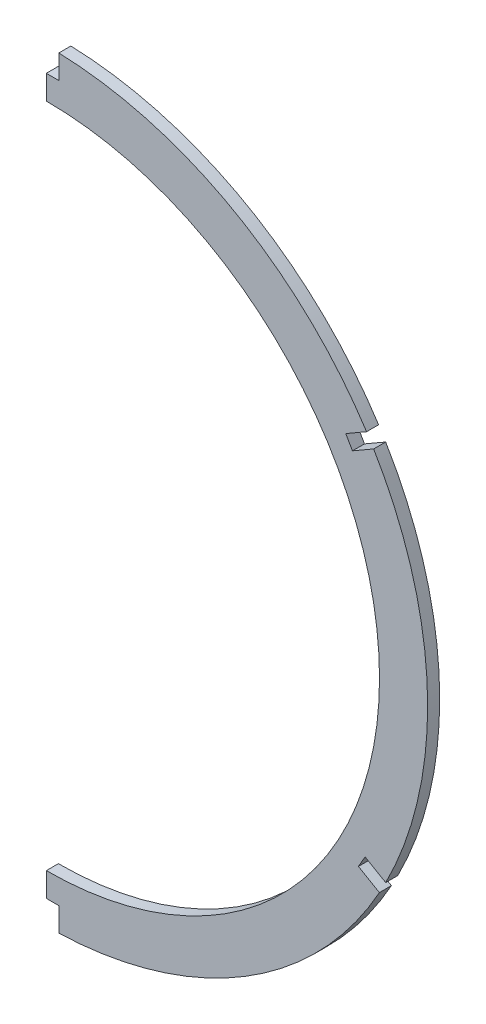
from build123d import *

# Parameters (mm, degrees)
BOSS_EXTRUDE1_DEPTH = 3.175
SKETCH3_W           = 149.303507008
SKETCH3_H           = 288.678903575
CUT_EXTRUDE1_DEPTH  = 147.667755045
SKETCH4_W           = 3.302
SKETCH4_H           = 9.965839279
CUT_EXTRUDE2_DEPTH  = 147.667755044


with BuildPart() as part:
    # Sketch2 → Boss-Extrude1 (new body)
    with BuildSketch(Plane.XY):
        with BuildLine():
            ThreePointArc((-1.783927604, 106.664181958), (-86.289926541, 57.796410124), (-89.548347912, -39.767444199))
            ThreePointArc((-89.548347912, -39.767444199), (-89.139366423, -40.557656379), (-88.723411943, -41.344220438))
            ThreePointArc((-88.723411943, -41.344220438), (-88.300763494, -42.126623343), (-87.87121564, -42.905259753))
            ThreePointArc((-87.87121564, -42.905259753), (0, -94.523651503), (87.87121564, -42.905259753))
            ThreePointArc((87.87121564, -42.905259753), (88.300763494, -42.126623343), (88.723411943, -41.344220438))
            ThreePointArc((88.723411943, -41.344220438), (89.139366423, -40.557656379), (89.548347912, -39.767444199))
            ThreePointArc((89.548347912, -39.767444199), (86.289926541, 57.796410124), (1.783927604, 106.664181958))
            ThreePointArc((1.783927604, 106.664181958), (0.891998866, 106.676045412), (0, 106.68))
            ThreePointArc((0, 106.68), (-0.891998866, 106.676045412), (-1.783927604, 106.664181958))
        make_face()
        with BuildLine():
            ThreePointArc((-7.652045127, 93.646303016), (0, -81.823651503), (7.652045127, 93.646303016))
            ThreePointArc((7.652045127, 93.646303016), (4.717664566, 93.853310885), (1.778000524, 93.962016248))
            ThreePointArc((1.778000524, 93.962016248), (0.889045735, 93.975503947), (0, 93.98))
            ThreePointArc((0, 93.98), (-0.889045735, 93.975503947), (-1.778000524, 93.962016248))
            ThreePointArc((-1.778000524, 93.962016248), (-4.717664566, 93.853310885), (-7.652045127, 93.646303016))
        make_face(mode=Mode.SUBTRACT)
    extrude(amount=-BOSS_EXTRUDE1_DEPTH)

    # Sketch3 → Cut-Extrude1 (cut, through all)
    with BuildSketch(Plane(origin=(0, 0, 0), x_dir=(0, 0, -1), z_dir=(1, 0, 0))):
        with Locations((2.160275602, 8.369276658)):
            Rectangle(SKETCH3_W, SKETCH3_H)
    extrude(amount=-CUT_EXTRUDE1_DEPTH, mode=Mode.SUBTRACT)

    # Sketch4 → Cut-Extrude2 (cut, through all)
    with BuildSketch(Plane.XY):
        with BuildLine():
            Line((3.302, -94.469447009), (3.302, -88.173651503))
            Line((3.302, -88.173651503), (0, -88.173651503))
            Line((0, -88.173651503), (0, -94.523651503))
            ThreePointArc((0, -94.523651503), (1.651222436, -94.510099467), (3.302, -94.469447009))
        make_face()
        with Locations((1.651, 105.31291964)):
            Rectangle(SKETCH4_W, SKETCH4_H)
        with BuildLine():
            Line((80.761862371, 54.45739012), (86.35548549, 57.686869933))
            ThreePointArc((86.35548549, 57.686869933), (85.436094759, 59.195036514), (84.490367241, 60.686829131))
            Line((84.490367241, 60.686829131), (78.996562371, 57.51497941))
            Line((78.996562371, 57.51497941), (80.761862371, 54.45739012))
        make_face()
        with BuildLine():
            Line((82.32974483, -39.7035932), (87.872184265, -42.9035221))
            ThreePointArc((87.872184265, -42.9035221), (88.718599471, -41.35322308), (89.537666015, -39.788302716))
            Line((89.537666015, -39.788302716), (84.09504483, -36.64600391))
            Line((84.09504483, -36.64600391), (82.32974483, -39.7035932))
        make_face()
    extrude(amount=-CUT_EXTRUDE2_DEPTH, mode=Mode.SUBTRACT)


solid = part.part
